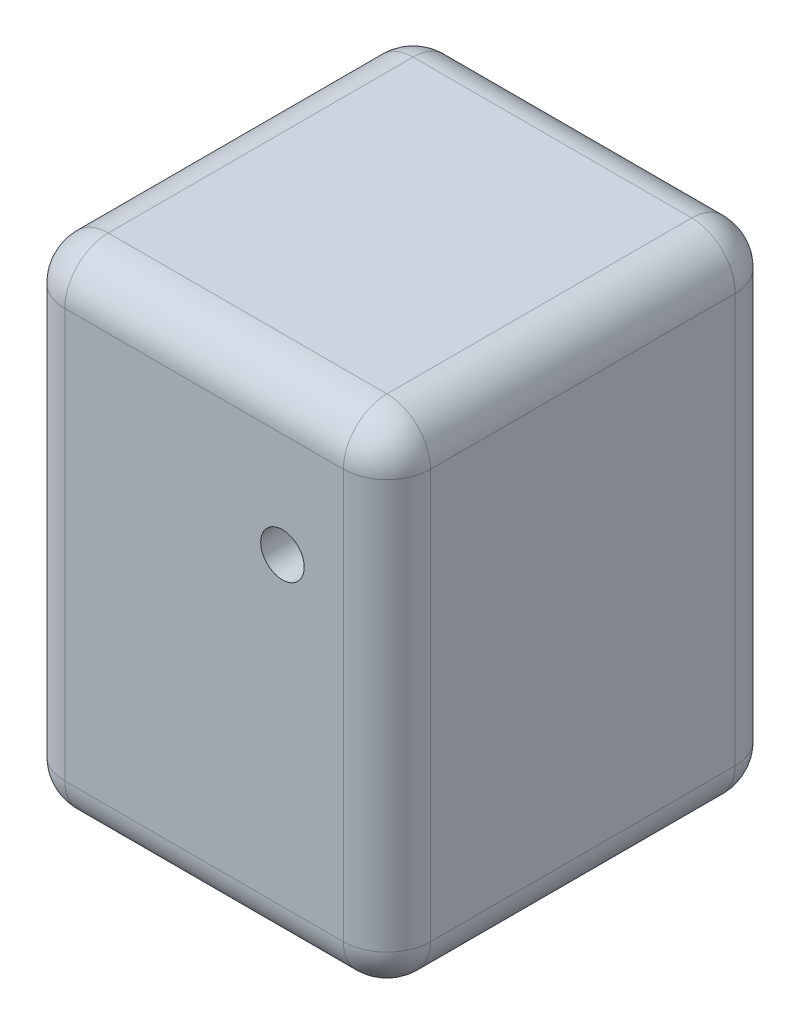
from build123d import *

# Parameters (mm, degrees)
SKETCH1_W           = 42
SKETCH1_H           = 57
SKETCH1_R           = 2.5
BOSS_EXTRUDE1_DEPTH = 45
FILLET1_R           = 5
FILLET2_R           = 5
SKETCH2_R           = 10
SKETCH2_R_2         = 2.5
BOSS_EXTRUDE2_DEPTH = 1
FILLET3_R           = 1


# Some blends are built 0.0001 mm under size
with BuildPart() as part:
    # Sketch1 → Boss-Extrude1 (new body)
    with BuildSketch(Plane.XY):
        with Locations((-9, -11.5)):
            Rectangle(SKETCH1_W, SKETCH1_H)
        with Locations(Location((0, 0, 0), (0, 0, 180))):
            Circle(SKETCH1_R, mode=Mode.SUBTRACT)
    extrude(amount=BOSS_EXTRUDE1_DEPTH)

    # Fillet1
    fillet1_edges = [part.edges().sort_by_distance(p)[0] for p in [
        (12, -11.5, 45),
        (-9, 17, 45),
        (-30, -11.5, 45),
        (-9, 17, 0),
        (12, -11.5, 0),
        (-30, -11.5, 0),
        (-30, 17, 22.5),
        (12, 17, 22.5),
        (12, -40, 22.5),
        (-30, -40, 22.5),
        (-9, -40, 45),
    ]]
    fillet(fillet1_edges, radius=FILLET1_R)

    # Fillet2
    # the kernel refuses this fillet: 5 mm, written as the material it takes off along each edge
    with BuildSketch(Plane(origin=(7, -35, 5), x_dir=(0, -1, 0), z_dir=(0, 0, -1))) as fillet2_piece_1_section:
        Polygon((0, 0), (FILLET2_R, 0), (FILLET2_R, -FILLET2_R), (0, -FILLET2_R), align=None)
    fillet2_piece_1 = extrude(amount=FILLET2_R, mode=Mode.PRIVATE)
    fillet2_piece_1 = fillet2_piece_1 - Plane(origin=(7, -35, 5), x_dir=(-0.7071067811865477, 0.7071067811865474, 0), z_dir=(0, 0, -1)) * Sphere(FILLET2_R, mode=Mode.PRIVATE)
    add(fillet2_piece_1, mode=Mode.SUBTRACT)
    with BuildSketch(Plane(origin=(-25, -35, 5), x_dir=(0, -1, 0), z_dir=(0, 0, -1))) as fillet2_piece_2_section:
        Polygon((0, 0), (FILLET2_R, 0), (FILLET2_R, FILLET2_R), (0, FILLET2_R), align=None)
    fillet2_piece_2 = extrude(amount=FILLET2_R, mode=Mode.PRIVATE)
    fillet2_piece_2 = fillet2_piece_2 - Plane(origin=(-25, -35, 5), x_dir=(0.7071067811865474, 0.7071067811865476, 0), z_dir=(0, 0, -1)) * Sphere(FILLET2_R, mode=Mode.PRIVATE)
    add(fillet2_piece_2, mode=Mode.SUBTRACT)
    with BuildSketch(Plane(origin=(7, -40, 0), x_dir=(0, 1, 0), z_dir=(-1, 0, 0))) as fillet2_piece_3:
        with BuildLine():
            CenterArc((FILLET2_R, -FILLET2_R), FILLET2_R, 90, 90)
            Line((0, -FILLET2_R), (0, 0))
            Line((0, 0), (FILLET2_R, 0))
        make_face()
    extrude(amount=32, mode=Mode.SUBTRACT)

    # Sketch2 → Boss-Extrude2 (add)
    with BuildSketch(Plane.ZY.offset(30)):
        with Locations(Location((22.5, -11.5, 0), (0, 0, 180))):
            Circle(SKETCH2_R)
        with Locations((22.5, -11.5)):
            Circle(SKETCH2_R_2, mode=Mode.SUBTRACT)
    extrude(amount=BOSS_EXTRUDE2_DEPTH)

    # Fillet3
    fillet3_edges = [part.edges().sort_by_distance(p)[0] for p in [
        (-31, -11.5, 32.5),
    ]]
    fillet(fillet3_edges, radius=FILLET3_R - 0.0001)  # a hair under: the kernel refuses the full size


solid = part.part
